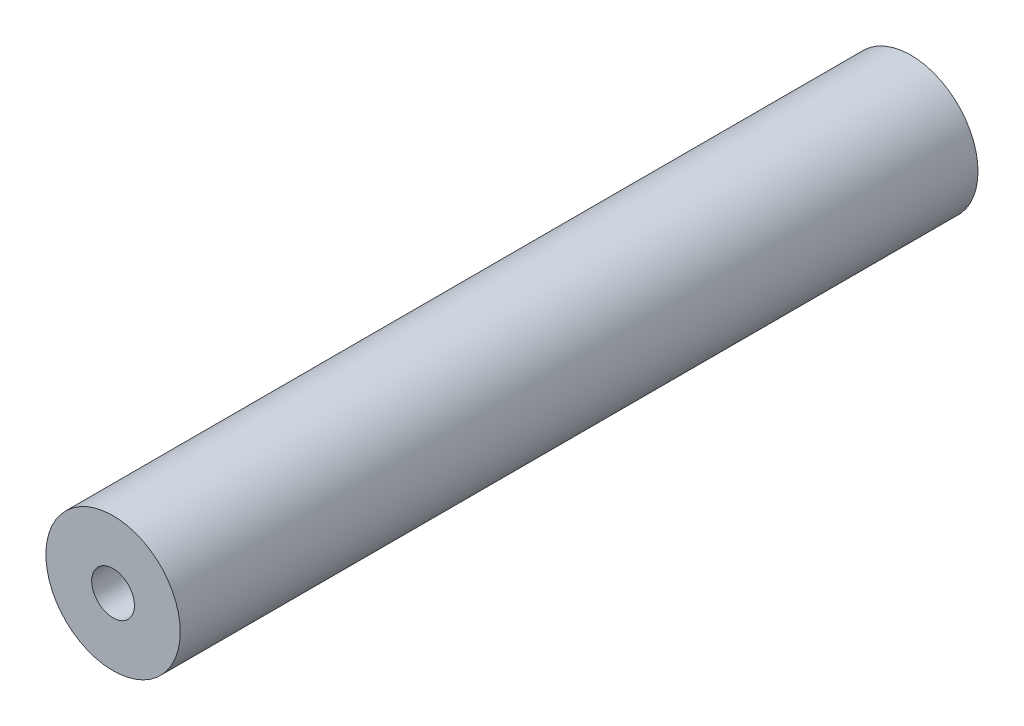
from build123d import *

# Parameters (mm, degrees)
SKETCH1_R                            = 6.35
BOSS_EXTRUDE1_DEPTH                  = 37.703125
F_10_32_TAPPED_HOLE1_D               = 4.0386
F_10_32_TAPPED_HOLE1_DEPTH           = 12.02944
F_10_32_TAPPED_HOLE1_TIP             = 1.213317848
F_10_32_TAPPED_HOLE1_ON_FACE_2_D     = 4.0386
F_10_32_TAPPED_HOLE1_ON_FACE_2_DEPTH = 12.02944
F_10_32_TAPPED_HOLE1_ON_FACE_2_TIP   = 1.213317848


with BuildPart() as part:
    # Sketch1 → Boss-Extrude1 (new, symmetric)
    with BuildSketch(Plane.XY):
        Circle(SKETCH1_R)
    extrude(amount=BOSS_EXTRUDE1_DEPTH, both=True)

    # #10-32 Tapped Hole1
    with Locations(Plane(origin=(0, 0, -37.703125), x_dir=(-1, 0, 0), z_dir=(0, 0, -1))):
        with Locations((0, 0)):
            Hole(F_10_32_TAPPED_HOLE1_D / 2, depth=F_10_32_TAPPED_HOLE1_DEPTH)
            with Locations((0, 0, -(F_10_32_TAPPED_HOLE1_DEPTH + F_10_32_TAPPED_HOLE1_TIP / 2))):  # 118° drill point
                Cone(0, F_10_32_TAPPED_HOLE1_D / 2, F_10_32_TAPPED_HOLE1_TIP, mode=Mode.SUBTRACT)

    # #10-32 Tapped Hole1 on face 2
    with Locations(Plane.XY.offset(37.703125)):
        with Locations((0, 0)):
            Hole(F_10_32_TAPPED_HOLE1_ON_FACE_2_D / 2, depth=F_10_32_TAPPED_HOLE1_ON_FACE_2_DEPTH)
            with Locations((0, 0, -(F_10_32_TAPPED_HOLE1_ON_FACE_2_DEPTH + F_10_32_TAPPED_HOLE1_ON_FACE_2_TIP / 2))):  # 118° drill point
                Cone(0, F_10_32_TAPPED_HOLE1_ON_FACE_2_D / 2, F_10_32_TAPPED_HOLE1_ON_FACE_2_TIP, mode=Mode.SUBTRACT)


solid = part.part
